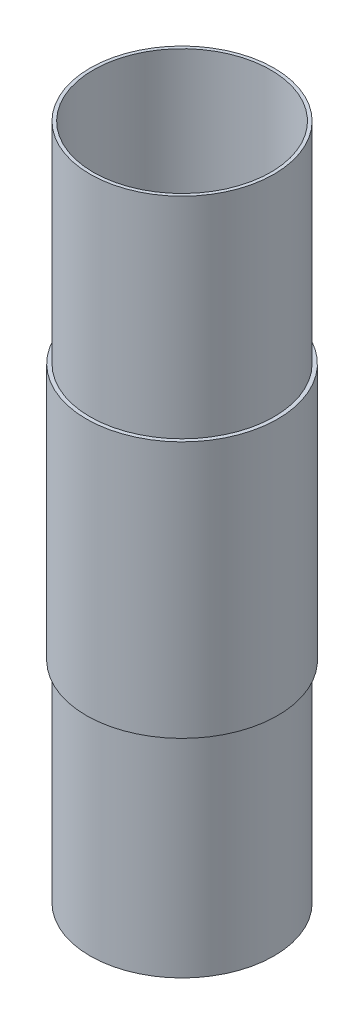
from build123d import *

# Parameters (mm, degrees)
SKETCH1_R           = 39.4
SKETCH1_R_2         = 38
BOSS_EXTRUDE1_DEPTH = 145
SKETCH1_3_R         = 41
SKETCH1_3_R_2       = 39.4
BOSS_EXTRUDE2_DEPTH = 55


with BuildPart() as part:
    # Sketch1 → Boss-Extrude1 (new, symmetric)
    with BuildSketch(Plane(origin=(0, 0, 0), x_dir=(1, 0, 0), z_dir=(0, 1, 0))):
        Circle(SKETCH1_R)
        Circle(SKETCH1_R_2, mode=Mode.SUBTRACT)
    extrude(amount=BOSS_EXTRUDE1_DEPTH, both=True)

    # Sketch1<3> → Boss-Extrude2 (add, symmetric)
    with BuildSketch(Plane(origin=(0, 0, 0), x_dir=(1, 0, 0), z_dir=(0, 1, 0))):
        Circle(SKETCH1_3_R)
        Circle(SKETCH1_3_R_2, mode=Mode.SUBTRACT)
    extrude(amount=BOSS_EXTRUDE2_DEPTH, both=True)


solid = part.part
